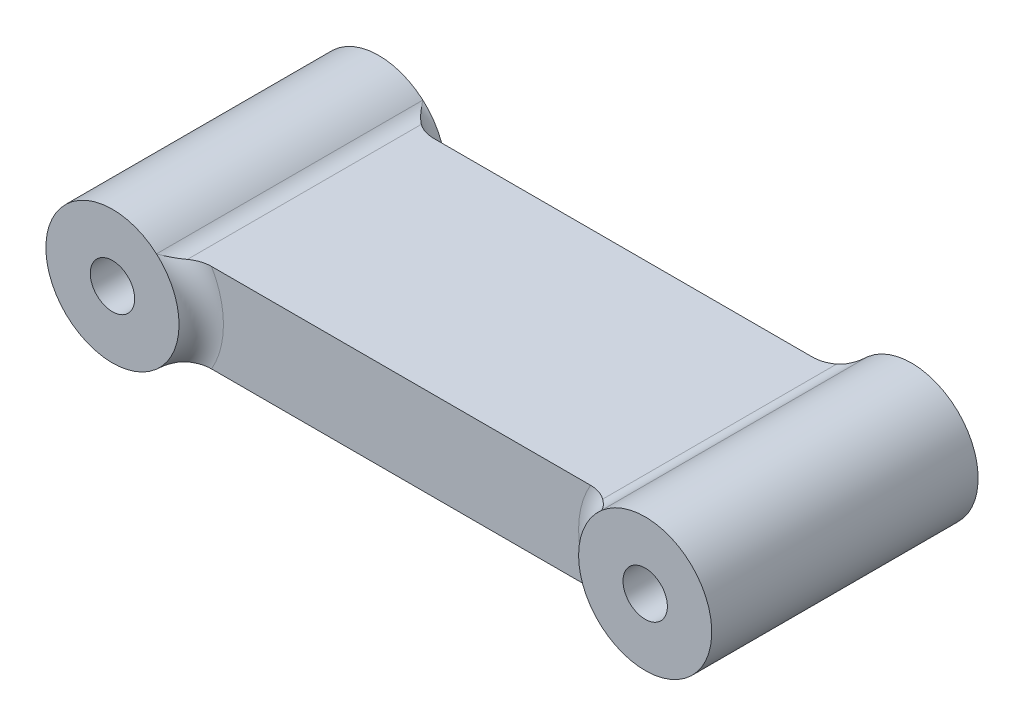
from build123d import *

# Parameters (mm, degrees)
SKETCH_2_R      = 3
SKETCH_2_R_2    = 1
EXTRUDE_1_DEPTH = 6
EXTRUDE_2_DEPTH = 5
SKETCH_6_R      = 3
SKETCH_6_R_2    = 1
EXTRUDE_3_DEPTH = 6
FILLET_1_R      = 1


with BuildPart() as part:
    # Эскиз2 → Бобышка-Вытянуть1 (new, symmetric)
    with BuildSketch(Plane.XY):
        Circle(SKETCH_2_R)
        Circle(SKETCH_2_R_2, mode=Mode.SUBTRACT)
    extrude(amount=EXTRUDE_1_DEPTH, both=True)

    # Эскиз4 → Бобышка-Вытянуть2 (add, symmetric)
    with BuildSketch(Plane.XY):
        with BuildLine():
            Line((2.236067977, 2), (23, 2))
            Line((23, 2), (23, -2))
            Line((23, -2), (2.236067977, -2))
            ThreePointArc((2.236067977, -2), (3, 0), (2.236067977, 2))
        make_face()
    extrude(amount=EXTRUDE_2_DEPTH, both=True)

    # Эскиз6 → Бобышка-Вытянуть3 (add, symmetric)
    with BuildSketch(Plane.XY):
        with Locations((24, 0)):
            Circle(SKETCH_6_R)
        with Locations((24, 0)):
            Circle(SKETCH_6_R_2, mode=Mode.SUBTRACT)
    extrude(amount=EXTRUDE_3_DEPTH, both=True)

    # Скругление1
    fillet_1_edges = [part.edges().sort_by_distance(p)[0] for p in [
        (2.802517077, 1.070466269, -5),
        (2.236067977, 2, 0),
        (2.236067977, -2, 0),
        (2.802517077, 1.070466269, 5),
        (21, 0, -5),
        (21.763932023, 2, 0),
        (21, 0, 5),
        (21.763932023, -2, 0),
    ]]
    fillet(fillet_1_edges, radius=FILLET_1_R - 0.0001)  # a hair under: the kernel refuses the full size


solid = part.part
